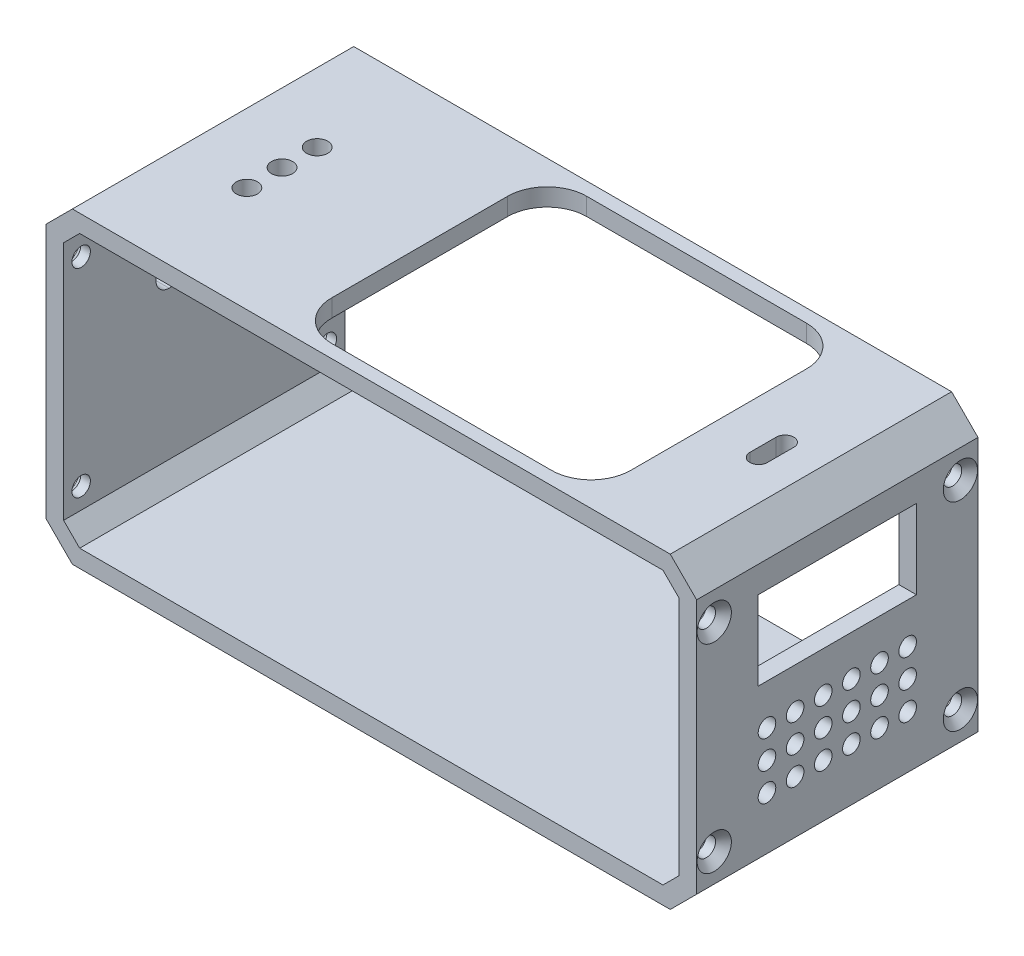
from build123d import *

# Parameters (mm, degrees)
SKETCH_1_W           = 74
SKETCH_1_H           = 32
EXTRUDE_1_DEPTH      = 35
CHAMFER_1_SIZE       = 3
CUT_EXTRUDE_1_DEPTH  = 61.172346892
CUT_EXTRUDE_2_REACH  = 55.543
CUT_EXTRUDE_3_REACH  = 55.543
SKETCH_5_R           = 1.2
SKETCH_6_R           = 1.05
CUT_EXTRUDE_4_DEPTH  = 84.493168733
CHAMFER_2_SIZE       = 0.9
CUT_EXTRUDE_5_REACH  = 55.543
CUT_EXTRUDE_6_REACH  = 85.493
CUT_EXTRUDE_7_REACH  = 85.493
SKETCH_9_W           = 4
SKETCH_9_H           = 2
FILLET_1_R           = 1
CUT_EXTRUDE_8_REACH  = 85.493
SKETCH_10_R          = 1
CUT_EXTRUDE_9_REACH  = 85.493
SKETCH_11_W          = 18
SKETCH_11_H          = 9
CUT_EXTRUDE_10_REACH = 85.493
SKETCH_12_R          = 1


with BuildPart() as part:
    # 草图1 → 凸台-拉伸1 (new body)
    with BuildSketch(Plane(origin=(0, 0, 0), x_dir=(1, 0, 0), z_dir=(0, 1, 0))):
        with Locations((0.036621478, 0.435)):
            Rectangle(SKETCH_1_W, SKETCH_1_H)
    extrude(amount=EXTRUDE_1_DEPTH)

    # 倒角1
    chamfer_1_edges = [part.edges().sort_by_distance(p)[0] for p in [
        (37.036621478, 35, -0.435),
        (-36.963378522, 35, -0.435),
        (37.036621478, 0, -0.435),
        (-36.963378522, 0, -0.435),
    ]]
    chamfer(chamfer_1_edges, length=CHAMFER_1_SIZE)

    # 草图2 → 切除-拉伸1 (cut, through all)
    with BuildSketch(Plane.XY.offset(15.565)):
        Polygon((-33.134951397, 2), (33.208194353, 2), (35.036621478, 3.828427125), (35.036621478, 31.171572875), (33.208194353, 33), (-33.134951397, 33), (-34.963378522, 31.171572875), (-34.963378522, 3.828427125), align=None)
    extrude(amount=-CUT_EXTRUDE_1_DEPTH, mode=Mode.SUBTRACT)

    # 草图4 → 切除-拉伸2 (cut, up to next)
    with BuildSketch(Plane(origin=(0, 35, 0), x_dir=(1, 0, 0), z_dir=(0, 1, 0)), mode=Mode.PRIVATE) as cut_extrude_2_sk1:
        with BuildLine():
            Line((-5.963378522, 14.935), (19.036621478, 14.935))
            ThreePointArc((19.036621478, 14.935), (22.218601993, 13.616980515), (23.536621478, 10.435))
            Line((23.536621478, 10.435), (23.536621478, -9.565))
            ThreePointArc((23.536621478, -9.565), (22.218601993, -12.746980515), (19.036621478, -14.065))
            Line((19.036621478, -14.065), (-5.963378522, -14.065))
            ThreePointArc((-5.963378522, -14.065), (-9.145359037, -12.746980515), (-10.463378522, -9.565))
            Line((-10.463378522, -9.565), (-10.463378522, 10.435))
            ThreePointArc((-10.463378522, 10.435), (-9.145359037, 13.616980515), (-5.963378522, 14.935))
        make_face()
    cut_extrude_2_tool1 = extrude(cut_extrude_2_sk1.sketch, amount=-CUT_EXTRUDE_2_REACH, mode=Mode.PRIVATE) & part.part
    add(cut_extrude_2_tool1.solids().sort_by_distance((6.536621, 35, -0.435))[0], mode=Mode.SUBTRACT)

    # 草图5 → 切除-拉伸3 (cut, up to next)
    with BuildSketch(Plane(origin=(0, 35, 0), x_dir=(1, 0, 0), z_dir=(0, 1, 0)), mode=Mode.PRIVATE) as cut_extrude_3_sk1:
        with Locations(Location((-26.117438699, 0.435, 0), (0, 0, 270))):
            Circle(SKETCH_5_R)
    cut_extrude_3_tool1 = extrude(cut_extrude_3_sk1.sketch, amount=-CUT_EXTRUDE_3_REACH, mode=Mode.PRIVATE) & part.part
    # 草图5 → 切除-拉伸3 (cut, up to next)
    with BuildSketch(Plane(origin=(0, 35, 0), x_dir=(1, 0, 0), z_dir=(0, 1, 0)), mode=Mode.PRIVATE) as cut_extrude_3_sk2:
        with Locations(Location((-26.117438699, 4.435, 0), (0, 0, 270))):
            Circle(SKETCH_5_R)
    cut_extrude_3_tool2 = extrude(cut_extrude_3_sk2.sketch, amount=-CUT_EXTRUDE_3_REACH, mode=Mode.PRIVATE) & part.part
    # 草图5 → 切除-拉伸3 (cut, up to next)
    with BuildSketch(Plane(origin=(0, 35, 0), x_dir=(1, 0, 0), z_dir=(0, 1, 0)), mode=Mode.PRIVATE) as cut_extrude_3_sk3:
        with Locations(Location((-26.117438699, -3.565, 0), (0, 0, 270))):
            Circle(SKETCH_5_R)
    cut_extrude_3_tool3 = extrude(cut_extrude_3_sk3.sketch, amount=-CUT_EXTRUDE_3_REACH, mode=Mode.PRIVATE) & part.part
    add(cut_extrude_3_tool1.solids().sort_by_distance((-26.117439, 35, -0.435))[0], mode=Mode.SUBTRACT)
    add(cut_extrude_3_tool2.solids().sort_by_distance((-26.117439, 35, -4.435))[0], mode=Mode.SUBTRACT)
    add(cut_extrude_3_tool3.solids().sort_by_distance((-26.117439, 35, 3.565))[0], mode=Mode.SUBTRACT)

    # 草图6 → 切除-拉伸4 (cut, through all)
    with BuildSketch(Plane(origin=(37.036621478, 0, 0), x_dir=(0, 0, -1), z_dir=(1, 0, 0))):
        with Locations((-13.565, 28.8)):
            Circle(SKETCH_6_R)
        with Locations((-13.565, 6.2)):
            Circle(SKETCH_6_R)
        with Locations((14.435, 6.2)):
            Circle(SKETCH_6_R)
        with Locations((14.435, 28.8)):
            Circle(SKETCH_6_R)
    extrude(amount=-CUT_EXTRUDE_4_DEPTH, mode=Mode.SUBTRACT)

    # 倒角2
    chamfer_2_edges = [part.edges().sort_by_distance(p)[0] for p in [
        (-36.963378522, 28.8, -13.385),
        (37.036621478, 28.8, -13.385),
        (-36.963378522, 6.2, -13.385),
        (37.036621478, 6.2, -13.385),
        (-36.963378522, 6.2, 14.615),
        (37.036621478, 6.2, 14.615),
        (-36.963378522, 28.8, 14.615),
        (37.036621478, 28.8, 14.615),
    ]]
    chamfer(chamfer_2_edges, length=CHAMFER_2_SIZE)

    # 草图7 → 切除-拉伸5 (cut, up to next)
    with BuildSketch(Plane(origin=(0, 35, 0), x_dir=(1, 0, 0), z_dir=(0, 1, 0)), mode=Mode.PRIVATE) as cut_extrude_5_sk1:
        with BuildLine():
            Line((30.536621478, 1.9890604), (30.536621478, -1.0109396))
            ThreePointArc((30.536621478, -1.0109396), (29.536621478, -2.0109396), (28.536621478, -1.0109396))
            Line((28.536621478, -1.0109396), (28.536621478, 1.9890604))
            ThreePointArc((28.536621478, 1.9890604), (29.536621478, 2.9890604), (30.536621478, 1.9890604))
        make_face()
    cut_extrude_5_tool1 = extrude(cut_extrude_5_sk1.sketch, amount=-CUT_EXTRUDE_5_REACH, mode=Mode.PRIVATE) & part.part
    add(cut_extrude_5_tool1.solids().sort_by_distance((29.536621, 35, -0.48906))[0], mode=Mode.SUBTRACT)

    # 草图8 → 切除-拉伸6 (cut, up to next)
    with BuildSketch(Plane.ZY.offset(36.963378522), mode=Mode.PRIVATE) as cut_extrude_6_sk1:
        with BuildLine():
            Line((-8.435, 23.7), (3.565, 23.7))
            ThreePointArc((3.565, 23.7), (5.065, 22.2), (3.565, 20.7))
            Line((3.565, 20.7), (-8.435, 20.7))
            ThreePointArc((-8.435, 20.7), (-9.935, 22.2), (-8.435, 23.7))
        make_face()
    cut_extrude_6_tool1 = extrude(cut_extrude_6_sk1.sketch, amount=-CUT_EXTRUDE_6_REACH, mode=Mode.PRIVATE) & part.part
    add(cut_extrude_6_tool1.solids().sort_by_distance((-36.963379, 22.2, -2.435))[0], mode=Mode.SUBTRACT)

    # 草图9 → 切除-拉伸7 (cut, up to next)
    with BuildSketch(Plane.ZY.offset(36.963378522), mode=Mode.PRIVATE) as cut_extrude_7_sk1:
        with Locations((-5.435, 16)):
            Rectangle(SKETCH_9_W, SKETCH_9_H)
    cut_extrude_7_tool1 = extrude(cut_extrude_7_sk1.sketch, amount=-CUT_EXTRUDE_7_REACH, mode=Mode.PRIVATE) & part.part
    add(cut_extrude_7_tool1.solids().sort_by_distance((-36.963379, 16, -5.435))[0], mode=Mode.SUBTRACT)

    # 圆角1
    fillet_1_edges = [part.edges().sort_by_distance(p)[0] for p in [
        (-35.963378522, 15, -3.435),
        (-35.963378522, 17, -3.435),
        (-35.963378522, 17, -7.435),
        (-35.963378522, 15, -7.435),
    ]]
    fillet(fillet_1_edges, radius=FILLET_1_R - 0.0001)  # a hair under: the kernel refuses the full size

    # 草图10 → 切除-拉伸8 (cut, up to next)
    with BuildSketch(Plane.ZY.offset(36.963378522), mode=Mode.PRIVATE) as cut_extrude_8_sk1:
        with Locations((-8.935, 28.6)):
            Circle(SKETCH_10_R)
    cut_extrude_8_tool1 = extrude(cut_extrude_8_sk1.sketch, amount=-CUT_EXTRUDE_8_REACH, mode=Mode.PRIVATE) & part.part
    # 草图10 → 切除-拉伸8 (cut, up to next)
    with BuildSketch(Plane.ZY.offset(36.963378522), mode=Mode.PRIVATE) as cut_extrude_8_sk2:
        with Locations((-5.735, 28.6)):
            Circle(SKETCH_10_R)
    cut_extrude_8_tool2 = extrude(cut_extrude_8_sk2.sketch, amount=-CUT_EXTRUDE_8_REACH, mode=Mode.PRIVATE) & part.part
    # 草图10 → 切除-拉伸8 (cut, up to next)
    with BuildSketch(Plane.ZY.offset(36.963378522), mode=Mode.PRIVATE) as cut_extrude_8_sk3:
        with Locations((-2.535, 28.6)):
            Circle(SKETCH_10_R)
    cut_extrude_8_tool3 = extrude(cut_extrude_8_sk3.sketch, amount=-CUT_EXTRUDE_8_REACH, mode=Mode.PRIVATE) & part.part
    # 草图10 → 切除-拉伸8 (cut, up to next)
    with BuildSketch(Plane.ZY.offset(36.963378522), mode=Mode.PRIVATE) as cut_extrude_8_sk4:
        with Locations((0.665, 28.6)):
            Circle(SKETCH_10_R)
    cut_extrude_8_tool4 = extrude(cut_extrude_8_sk4.sketch, amount=-CUT_EXTRUDE_8_REACH, mode=Mode.PRIVATE) & part.part
    # 草图10 → 切除-拉伸8 (cut, up to next)
    with BuildSketch(Plane.ZY.offset(36.963378522), mode=Mode.PRIVATE) as cut_extrude_8_sk5:
        with Locations((3.865, 28.6)):
            Circle(SKETCH_10_R)
    cut_extrude_8_tool5 = extrude(cut_extrude_8_sk5.sketch, amount=-CUT_EXTRUDE_8_REACH, mode=Mode.PRIVATE) & part.part
    # 草图10 → 切除-拉伸8 (cut, up to next)
    with BuildSketch(Plane.ZY.offset(36.963378522), mode=Mode.PRIVATE) as cut_extrude_8_sk6:
        with Locations((-5.735, 25.4)):
            Circle(SKETCH_10_R)
    cut_extrude_8_tool6 = extrude(cut_extrude_8_sk6.sketch, amount=-CUT_EXTRUDE_8_REACH, mode=Mode.PRIVATE) & part.part
    # 草图10 → 切除-拉伸8 (cut, up to next)
    with BuildSketch(Plane.ZY.offset(36.963378522), mode=Mode.PRIVATE) as cut_extrude_8_sk7:
        with Locations((-2.535, 25.4)):
            Circle(SKETCH_10_R)
    cut_extrude_8_tool7 = extrude(cut_extrude_8_sk7.sketch, amount=-CUT_EXTRUDE_8_REACH, mode=Mode.PRIVATE) & part.part
    # 草图10 → 切除-拉伸8 (cut, up to next)
    with BuildSketch(Plane.ZY.offset(36.963378522), mode=Mode.PRIVATE) as cut_extrude_8_sk8:
        with Locations((0.665, 25.4)):
            Circle(SKETCH_10_R)
    cut_extrude_8_tool8 = extrude(cut_extrude_8_sk8.sketch, amount=-CUT_EXTRUDE_8_REACH, mode=Mode.PRIVATE) & part.part
    # 草图10 → 切除-拉伸8 (cut, up to next)
    with BuildSketch(Plane.ZY.offset(36.963378522), mode=Mode.PRIVATE) as cut_extrude_8_sk9:
        with Locations((3.865, 25.4)):
            Circle(SKETCH_10_R)
    cut_extrude_8_tool9 = extrude(cut_extrude_8_sk9.sketch, amount=-CUT_EXTRUDE_8_REACH, mode=Mode.PRIVATE) & part.part
    # 草图10 → 切除-拉伸8 (cut, up to next)
    with BuildSketch(Plane.ZY.offset(36.963378522), mode=Mode.PRIVATE) as cut_extrude_8_sk10:
        with Locations((-8.935, 25.4)):
            Circle(SKETCH_10_R)
    cut_extrude_8_tool10 = extrude(cut_extrude_8_sk10.sketch, amount=-CUT_EXTRUDE_8_REACH, mode=Mode.PRIVATE) & part.part
    add(cut_extrude_8_tool1.solids().sort_by_distance((-36.963379, 28.6, -8.935))[0], mode=Mode.SUBTRACT)
    add(cut_extrude_8_tool2.solids().sort_by_distance((-36.963379, 28.6, -5.735))[0], mode=Mode.SUBTRACT)
    add(cut_extrude_8_tool3.solids().sort_by_distance((-36.963379, 28.6, -2.535))[0], mode=Mode.SUBTRACT)
    add(cut_extrude_8_tool4.solids().sort_by_distance((-36.963379, 28.6, 0.665))[0], mode=Mode.SUBTRACT)
    add(cut_extrude_8_tool5.solids().sort_by_distance((-36.963379, 28.6, 3.865))[0], mode=Mode.SUBTRACT)
    add(cut_extrude_8_tool6.solids().sort_by_distance((-36.963379, 25.4, -5.735))[0], mode=Mode.SUBTRACT)
    add(cut_extrude_8_tool7.solids().sort_by_distance((-36.963379, 25.4, -2.535))[0], mode=Mode.SUBTRACT)
    add(cut_extrude_8_tool8.solids().sort_by_distance((-36.963379, 25.4, 0.665))[0], mode=Mode.SUBTRACT)
    add(cut_extrude_8_tool9.solids().sort_by_distance((-36.963379, 25.4, 3.865))[0], mode=Mode.SUBTRACT)
    add(cut_extrude_8_tool10.solids().sort_by_distance((-36.963379, 25.4, -8.935))[0], mode=Mode.SUBTRACT)

    # 草图11 → 切除-拉伸9 (cut, up to next)
    with BuildSketch(Plane(origin=(37.036621478, 0, 0), x_dir=(0, 0, -1), z_dir=(1, 0, 0)), mode=Mode.PRIVATE) as cut_extrude_9_sk1:
        with Locations((0.435, 24.5)):
            Rectangle(SKETCH_11_W, SKETCH_11_H)
    cut_extrude_9_tool1 = extrude(cut_extrude_9_sk1.sketch, amount=-CUT_EXTRUDE_9_REACH, mode=Mode.PRIVATE) & part.part
    add(cut_extrude_9_tool1.solids().sort_by_distance((37.036621, 24.5, -0.435))[0], mode=Mode.SUBTRACT)

    # 草图12 → 切除-拉伸10 (cut, up to next)
    with BuildSketch(Plane(origin=(37.036621478, 0, 0), x_dir=(0, 0, -1), z_dir=(1, 0, 0)), mode=Mode.PRIVATE) as cut_extrude_10_sk1:
        with Locations((-7.565, 9)):
            Circle(SKETCH_12_R)
    cut_extrude_10_tool1 = extrude(cut_extrude_10_sk1.sketch, amount=-CUT_EXTRUDE_10_REACH, mode=Mode.PRIVATE) & part.part
    # 草图12 → 切除-拉伸10 (cut, up to next)
    with BuildSketch(Plane(origin=(37.036621478, 0, 0), x_dir=(0, 0, -1), z_dir=(1, 0, 0)), mode=Mode.PRIVATE) as cut_extrude_10_sk2:
        with Locations((-4.365, 9)):
            Circle(SKETCH_12_R)
    cut_extrude_10_tool2 = extrude(cut_extrude_10_sk2.sketch, amount=-CUT_EXTRUDE_10_REACH, mode=Mode.PRIVATE) & part.part
    # 草图12 → 切除-拉伸10 (cut, up to next)
    with BuildSketch(Plane(origin=(37.036621478, 0, 0), x_dir=(0, 0, -1), z_dir=(1, 0, 0)), mode=Mode.PRIVATE) as cut_extrude_10_sk3:
        with Locations((-1.165, 9)):
            Circle(SKETCH_12_R)
    cut_extrude_10_tool3 = extrude(cut_extrude_10_sk3.sketch, amount=-CUT_EXTRUDE_10_REACH, mode=Mode.PRIVATE) & part.part
    # 草图12 → 切除-拉伸10 (cut, up to next)
    with BuildSketch(Plane(origin=(37.036621478, 0, 0), x_dir=(0, 0, -1), z_dir=(1, 0, 0)), mode=Mode.PRIVATE) as cut_extrude_10_sk4:
        with Locations((2.035, 9)):
            Circle(SKETCH_12_R)
    cut_extrude_10_tool4 = extrude(cut_extrude_10_sk4.sketch, amount=-CUT_EXTRUDE_10_REACH, mode=Mode.PRIVATE) & part.part
    # 草图12 → 切除-拉伸10 (cut, up to next)
    with BuildSketch(Plane(origin=(37.036621478, 0, 0), x_dir=(0, 0, -1), z_dir=(1, 0, 0)), mode=Mode.PRIVATE) as cut_extrude_10_sk5:
        with Locations((5.235, 9)):
            Circle(SKETCH_12_R)
    cut_extrude_10_tool5 = extrude(cut_extrude_10_sk5.sketch, amount=-CUT_EXTRUDE_10_REACH, mode=Mode.PRIVATE) & part.part
    # 草图12 → 切除-拉伸10 (cut, up to next)
    with BuildSketch(Plane(origin=(37.036621478, 0, 0), x_dir=(0, 0, -1), z_dir=(1, 0, 0)), mode=Mode.PRIVATE) as cut_extrude_10_sk6:
        with Locations((8.435, 9)):
            Circle(SKETCH_12_R)
    cut_extrude_10_tool6 = extrude(cut_extrude_10_sk6.sketch, amount=-CUT_EXTRUDE_10_REACH, mode=Mode.PRIVATE) & part.part
    # 草图12 → 切除-拉伸10 (cut, up to next)
    with BuildSketch(Plane(origin=(37.036621478, 0, 0), x_dir=(0, 0, -1), z_dir=(1, 0, 0)), mode=Mode.PRIVATE) as cut_extrude_10_sk7:
        with Locations((-4.365, 12.2)):
            Circle(SKETCH_12_R)
    cut_extrude_10_tool7 = extrude(cut_extrude_10_sk7.sketch, amount=-CUT_EXTRUDE_10_REACH, mode=Mode.PRIVATE) & part.part
    # 草图12 → 切除-拉伸10 (cut, up to next)
    with BuildSketch(Plane(origin=(37.036621478, 0, 0), x_dir=(0, 0, -1), z_dir=(1, 0, 0)), mode=Mode.PRIVATE) as cut_extrude_10_sk8:
        with Locations((-1.165, 12.2)):
            Circle(SKETCH_12_R)
    cut_extrude_10_tool8 = extrude(cut_extrude_10_sk8.sketch, amount=-CUT_EXTRUDE_10_REACH, mode=Mode.PRIVATE) & part.part
    # 草图12 → 切除-拉伸10 (cut, up to next)
    with BuildSketch(Plane(origin=(37.036621478, 0, 0), x_dir=(0, 0, -1), z_dir=(1, 0, 0)), mode=Mode.PRIVATE) as cut_extrude_10_sk9:
        with Locations((2.035, 12.2)):
            Circle(SKETCH_12_R)
    cut_extrude_10_tool9 = extrude(cut_extrude_10_sk9.sketch, amount=-CUT_EXTRUDE_10_REACH, mode=Mode.PRIVATE) & part.part
    # 草图12 → 切除-拉伸10 (cut, up to next)
    with BuildSketch(Plane(origin=(37.036621478, 0, 0), x_dir=(0, 0, -1), z_dir=(1, 0, 0)), mode=Mode.PRIVATE) as cut_extrude_10_sk10:
        with Locations((5.235, 12.2)):
            Circle(SKETCH_12_R)
    cut_extrude_10_tool10 = extrude(cut_extrude_10_sk10.sketch, amount=-CUT_EXTRUDE_10_REACH, mode=Mode.PRIVATE) & part.part
    # 草图12 → 切除-拉伸10 (cut, up to next)
    with BuildSketch(Plane(origin=(37.036621478, 0, 0), x_dir=(0, 0, -1), z_dir=(1, 0, 0)), mode=Mode.PRIVATE) as cut_extrude_10_sk11:
        with Locations((8.435, 12.2)):
            Circle(SKETCH_12_R)
    cut_extrude_10_tool11 = extrude(cut_extrude_10_sk11.sketch, amount=-CUT_EXTRUDE_10_REACH, mode=Mode.PRIVATE) & part.part
    # 草图12 → 切除-拉伸10 (cut, up to next)
    with BuildSketch(Plane(origin=(37.036621478, 0, 0), x_dir=(0, 0, -1), z_dir=(1, 0, 0)), mode=Mode.PRIVATE) as cut_extrude_10_sk12:
        with Locations((-4.365, 15.4)):
            Circle(SKETCH_12_R)
    cut_extrude_10_tool12 = extrude(cut_extrude_10_sk12.sketch, amount=-CUT_EXTRUDE_10_REACH, mode=Mode.PRIVATE) & part.part
    # 草图12 → 切除-拉伸10 (cut, up to next)
    with BuildSketch(Plane(origin=(37.036621478, 0, 0), x_dir=(0, 0, -1), z_dir=(1, 0, 0)), mode=Mode.PRIVATE) as cut_extrude_10_sk13:
        with Locations((-1.165, 15.4)):
            Circle(SKETCH_12_R)
    cut_extrude_10_tool13 = extrude(cut_extrude_10_sk13.sketch, amount=-CUT_EXTRUDE_10_REACH, mode=Mode.PRIVATE) & part.part
    # 草图12 → 切除-拉伸10 (cut, up to next)
    with BuildSketch(Plane(origin=(37.036621478, 0, 0), x_dir=(0, 0, -1), z_dir=(1, 0, 0)), mode=Mode.PRIVATE) as cut_extrude_10_sk14:
        with Locations((2.035, 15.4)):
            Circle(SKETCH_12_R)
    cut_extrude_10_tool14 = extrude(cut_extrude_10_sk14.sketch, amount=-CUT_EXTRUDE_10_REACH, mode=Mode.PRIVATE) & part.part
    # 草图12 → 切除-拉伸10 (cut, up to next)
    with BuildSketch(Plane(origin=(37.036621478, 0, 0), x_dir=(0, 0, -1), z_dir=(1, 0, 0)), mode=Mode.PRIVATE) as cut_extrude_10_sk15:
        with Locations((5.235, 15.4)):
            Circle(SKETCH_12_R)
    cut_extrude_10_tool15 = extrude(cut_extrude_10_sk15.sketch, amount=-CUT_EXTRUDE_10_REACH, mode=Mode.PRIVATE) & part.part
    # 草图12 → 切除-拉伸10 (cut, up to next)
    with BuildSketch(Plane(origin=(37.036621478, 0, 0), x_dir=(0, 0, -1), z_dir=(1, 0, 0)), mode=Mode.PRIVATE) as cut_extrude_10_sk16:
        with Locations((8.435, 15.4)):
            Circle(SKETCH_12_R)
    cut_extrude_10_tool16 = extrude(cut_extrude_10_sk16.sketch, amount=-CUT_EXTRUDE_10_REACH, mode=Mode.PRIVATE) & part.part
    # 草图12 → 切除-拉伸10 (cut, up to next)
    with BuildSketch(Plane(origin=(37.036621478, 0, 0), x_dir=(0, 0, -1), z_dir=(1, 0, 0)), mode=Mode.PRIVATE) as cut_extrude_10_sk17:
        with Locations((-7.565, 12.2)):
            Circle(SKETCH_12_R)
    cut_extrude_10_tool17 = extrude(cut_extrude_10_sk17.sketch, amount=-CUT_EXTRUDE_10_REACH, mode=Mode.PRIVATE) & part.part
    # 草图12 → 切除-拉伸10 (cut, up to next)
    with BuildSketch(Plane(origin=(37.036621478, 0, 0), x_dir=(0, 0, -1), z_dir=(1, 0, 0)), mode=Mode.PRIVATE) as cut_extrude_10_sk18:
        with Locations((-7.565, 15.4)):
            Circle(SKETCH_12_R)
    cut_extrude_10_tool18 = extrude(cut_extrude_10_sk18.sketch, amount=-CUT_EXTRUDE_10_REACH, mode=Mode.PRIVATE) & part.part
    add(cut_extrude_10_tool1.solids().sort_by_distance((37.036621, 9, 7.565))[0], mode=Mode.SUBTRACT)
    add(cut_extrude_10_tool2.solids().sort_by_distance((37.036621, 9, 4.365))[0], mode=Mode.SUBTRACT)
    add(cut_extrude_10_tool3.solids().sort_by_distance((37.036621, 9, 1.165))[0], mode=Mode.SUBTRACT)
    add(cut_extrude_10_tool4.solids().sort_by_distance((37.036621, 9, -2.035))[0], mode=Mode.SUBTRACT)
    add(cut_extrude_10_tool5.solids().sort_by_distance((37.036621, 9, -5.235))[0], mode=Mode.SUBTRACT)
    add(cut_extrude_10_tool6.solids().sort_by_distance((37.036621, 9, -8.435))[0], mode=Mode.SUBTRACT)
    add(cut_extrude_10_tool7.solids().sort_by_distance((37.036621, 12.2, 4.365))[0], mode=Mode.SUBTRACT)
    add(cut_extrude_10_tool8.solids().sort_by_distance((37.036621, 12.2, 1.165))[0], mode=Mode.SUBTRACT)
    add(cut_extrude_10_tool9.solids().sort_by_distance((37.036621, 12.2, -2.035))[0], mode=Mode.SUBTRACT)
    add(cut_extrude_10_tool10.solids().sort_by_distance((37.036621, 12.2, -5.235))[0], mode=Mode.SUBTRACT)
    add(cut_extrude_10_tool11.solids().sort_by_distance((37.036621, 12.2, -8.435))[0], mode=Mode.SUBTRACT)
    add(cut_extrude_10_tool12.solids().sort_by_distance((37.036621, 15.4, 4.365))[0], mode=Mode.SUBTRACT)
    add(cut_extrude_10_tool13.solids().sort_by_distance((37.036621, 15.4, 1.165))[0], mode=Mode.SUBTRACT)
    add(cut_extrude_10_tool14.solids().sort_by_distance((37.036621, 15.4, -2.035))[0], mode=Mode.SUBTRACT)
    add(cut_extrude_10_tool15.solids().sort_by_distance((37.036621, 15.4, -5.235))[0], mode=Mode.SUBTRACT)
    add(cut_extrude_10_tool16.solids().sort_by_distance((37.036621, 15.4, -8.435))[0], mode=Mode.SUBTRACT)
    add(cut_extrude_10_tool17.solids().sort_by_distance((37.036621, 12.2, 7.565))[0], mode=Mode.SUBTRACT)
    add(cut_extrude_10_tool18.solids().sort_by_distance((37.036621, 15.4, 7.565))[0], mode=Mode.SUBTRACT)


solid = part.part
